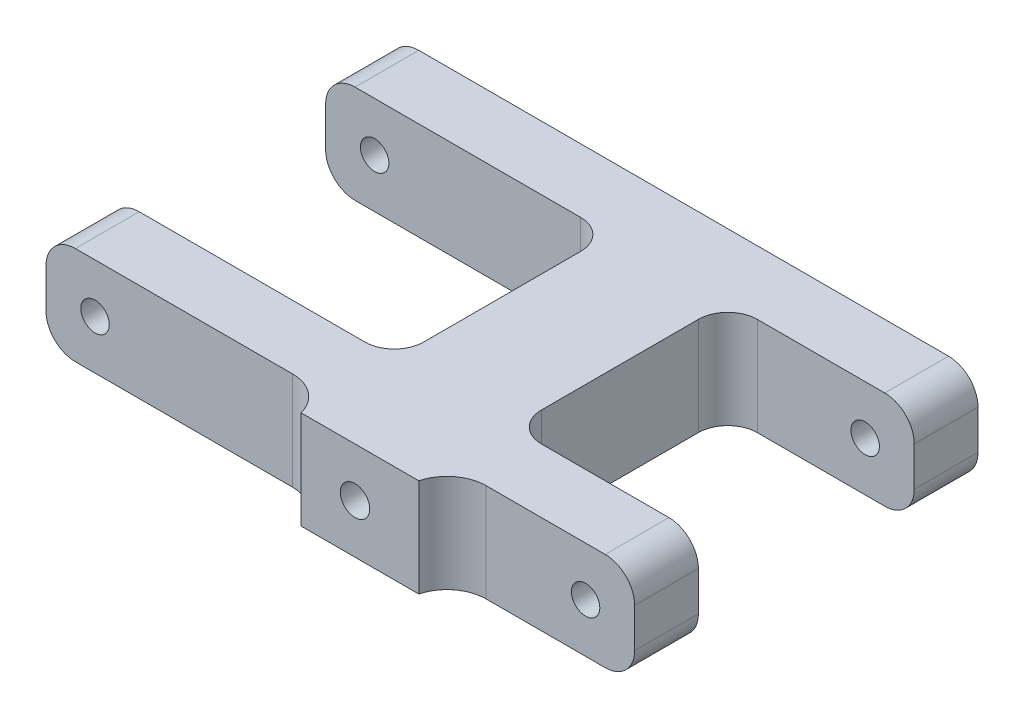
from build123d import *

# Parameters (mm, degrees)
SKETCH1_W               = 60
SKETCH1_H               = 35
BOSS_EXTRUDE1_DEPTH     = 10
SKETCH2_W               = 22
SKETCH2_H               = 10
CUT_EXTRUDE1_DEPTH      = 19
SKETCH3_W               = 22
SKETCH3_H               = 10
CUT_EXTRUDE2_DEPTH      = 29
SKETCH5_R               = 1.45
CUT_EXTRUDE4_DEPTH      = 71.178344238
FILLET1_R               = 3
FILLET2_R               = 3
SKETCH7_W               = 12
SKETCH7_H               = 10
BOSS_EXTRUDE2_DEPTH     = 3
CUT_EXTRUDE5_DEPTH      = 3
CUT_EXTRUDE5_DEPTH_BACK = 15
SKETCH6_R               = 1.5
FILLET3_R               = 4


with BuildPart() as part:
    # Sketch1 → Boss-Extrude1 (new body)
    with BuildSketch(Plane(origin=(0, 0, 0), x_dir=(1, 0, 0), z_dir=(0, 1, 0))):
        with Locations((30, -17.5)):
            Rectangle(SKETCH1_W, SKETCH1_H)
    extrude(amount=BOSS_EXTRUDE1_DEPTH)

    # Sketch2 → Cut-Extrude1 (cut)
    with BuildSketch(Plane(origin=(60, 0, 0), x_dir=(0, 0, -1), z_dir=(1, 0, 0))):
        with Locations((-17.5, 5)):
            Rectangle(SKETCH2_W, SKETCH2_H)
    extrude(amount=-CUT_EXTRUDE1_DEPTH, mode=Mode.SUBTRACT)

    # Sketch3 → Cut-Extrude2 (cut)
    with BuildSketch(Plane.ZY):
        with Locations((17.5, 5)):
            Rectangle(SKETCH3_W, SKETCH3_H)
    extrude(amount=-CUT_EXTRUDE2_DEPTH, mode=Mode.SUBTRACT)

    # Sketch5 → Cut-Extrude4 (cut, through all)
    with BuildSketch(Plane.XY.offset(35)):
        with Locations((5, 5)):
            Circle(SKETCH5_R)
        with Locations((55, 5)):
            Circle(SKETCH5_R)
    extrude(amount=-CUT_EXTRUDE4_DEPTH, mode=Mode.SUBTRACT)

    # Fillet1
    fillet1_edges = [part.edges().sort_by_distance(p)[0] for p in [
        (60, 10, 31.75),
        (60, 0, 3.25),
        (60, 10, 3.25),
        (0, 0, 31.75),
        (0, 10, 31.75),
        (0, 10, 3.25),
        (60, 0, 31.75),
        (0, 0, 3.25),
    ]]
    fillet(fillet1_edges, radius=FILLET1_R)

    # Fillet2
    fillet2_edges = [part.edges().sort_by_distance(p)[0] for p in [
        (41, 5, 28.5),
        (41, 5, 6.5),
        (29, 5, 6.5),
        (29, 5, 28.5),
    ]]
    fillet(fillet2_edges, radius=FILLET2_R)

    # Sketch7 → Boss-Extrude2 (add)
    with BuildSketch(Plane.XY.offset(35)):
        with Locations((35, 5)):
            Rectangle(SKETCH7_W, SKETCH7_H)
    extrude(amount=BOSS_EXTRUDE2_DEPTH)

    # Sketch6 → Cut-Extrude5 (cut, two sides: drawn at the far end of the back side and taken through both)
    with BuildSketch(Plane.XY.offset(35).offset(-CUT_EXTRUDE5_DEPTH_BACK)):
        with Locations((34.5, 5)):
            Circle(SKETCH6_R)
    extrude(amount=CUT_EXTRUDE5_DEPTH + CUT_EXTRUDE5_DEPTH_BACK, mode=Mode.SUBTRACT)

    # Fillet3
    # the kernel refuses this fillet: 4 mm, written as the material it adds along each edge
    with BuildSketch(Plane(origin=(41, 10, 35), x_dir=(0, 0, 1), z_dir=(0, -1, 0))) as fillet3_piece_1:
        with BuildLine():
            CenterArc((4, -3.872983346), FILLET3_R, 104.477512186, 75.522487814)
            Line((0, -3.872983346), (-0.08, -3.872983346))
            Line((-0.08, -3.872983346), (-0.08, 0))
            Line((-0.08, 0), (0, 0.08))
            ThreePointArc((0, 0.08), (1.5, 0.08), (2.98, 0.077459667))
            Line((2.98, 0.077459667), (3, 0))
        make_face()
    extrude(amount=10)
    with BuildSketch(Plane(origin=(29, 0, 35), x_dir=(-1, 0, 0), z_dir=(0, 1, 0))) as fillet3_piece_2:
        with BuildLine():
            CenterArc((3.872983346, 4), FILLET3_R, 194.477512186, 75.522487814)
            Line((0, 3), (-0.077459667, 2.98))
            ThreePointArc((-0.077459667, 2.98), (-0.08, 1.5), (-0.08, 0))
            Line((-0.08, 0), (0, -0.08))
            Line((0, -0.08), (3.872983346, -0.08))
            Line((3.872983346, -0.08), (3.872983346, 0))
        make_face()
    extrude(amount=10)


solid = part.part
